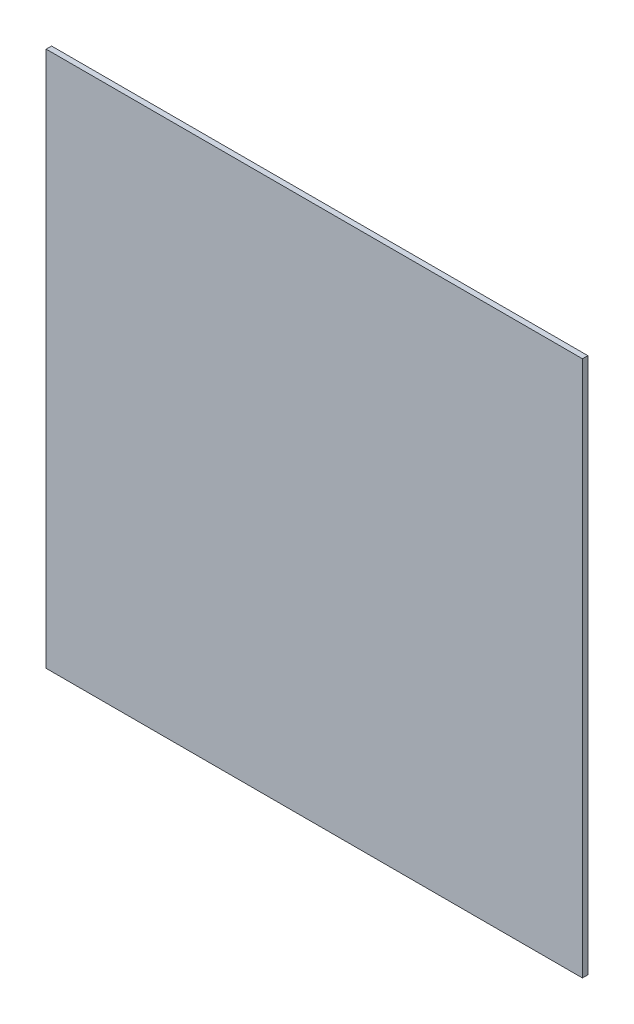
from build123d import *

# Parameters (mm, degrees)
SKETCH1_W           = 12.573
SKETCH1_H           = 12.573
BOSS_EXTRUDE1_DEPTH = 0.127
WRAP3_DEPTH         = 0.0254


# Read off the part's stored shape, not the designer's step: Wrap3
with BuildPart() as part:
    # Sketch1 → Boss-Extrude1 (new body)
    with BuildSketch(Plane.XY):
        with Locations((-12.7, -106.3625)):
            Rectangle(SKETCH1_W, SKETCH1_H)
    extrude(amount=BOSS_EXTRUDE1_DEPTH)

    # Wrap3 outline → Wrap3 (cut)
    # profile 1 of 7: a face of its own
    with BuildSketch(Plane.XY):
        with BuildLine():
            add(Edge.make_bspline(
                [(-14.420012161, -110.404390599), (-14.402067127, -110.404685135), (-14.368435947, -110.405237132), (-14.321816879, -110.41486782), (-14.281989467, -110.429283689), (-14.249047465, -110.450132857), (-14.22337003, -110.477658815), (-14.206106559, -110.511449866), (-14.194879537, -110.550675482), (-14.194017772, -110.578868519), (-14.193559673, -110.593855431)],
                knots=[0, 0, 0, 0, 0.159031159, 0.298043772, 0.420522955, 0.533343019, 0.640927553, 0.750451351, 0.867344419, 1, 1, 1, 1], degree=3))
            Line((-14.420012161, -110.404390599), (-15.545155125, -110.404390599))
            Line((-15.545155125, -110.404390599), (-15.545155125, -109.630526787))
            Line((-15.545155125, -109.630526787), (-14.756613257, -109.630526787))
            add(Edge.make_bspline(
                [(-14.512445471, -109.439061883), (-14.512654343, -109.454704013), (-14.513048204, -109.484199609), (-14.523992098, -109.525215161), (-14.542293289, -109.560343231), (-14.570025574, -109.588322996), (-14.605929257, -109.609317156), (-14.649498036, -109.622705682), (-14.700484045, -109.630927974), (-14.73700747, -109.63066692), (-14.756613257, -109.630526787)],
                knots=[0, 0, 0, 0, 0.130278168, 0.245659146, 0.351243539, 0.457674705, 0.570161798, 0.695317343, 0.836446248, 1, 1, 1, 1], degree=3))
            add(Edge.make_bspline(
                [(-14.766257906, -109.251599079), (-14.745028688, -109.25216019), (-14.705636029, -109.25320138), (-14.650881794, -109.259369804), (-14.60626865, -109.273761249), (-14.569582976, -109.291864533), (-14.542713034, -109.31902493), (-14.524616227, -109.3528551), (-14.513753098, -109.393710758), (-14.512902863, -109.423198595), (-14.512445471, -109.439061883)],
                knots=[0, 0, 0, 0, 0.174472791, 0.323749439, 0.450229917, 0.558081588, 0.656219595, 0.758386635, 0.870021586, 1, 1, 1, 1], degree=3))
            Line((-14.766257906, -109.251599079), (-15.545557745, -109.251599079))
            Line((-15.545557745, -109.251599079), (-15.545155125, -107.963381163))
            add(Edge.make_bspline(
                [(-15.731950153, -107.7145435), (-15.71675594, -107.714767904), (-15.687925924, -107.715193696), (-15.648036288, -107.726016918), (-15.614455204, -107.743782739), (-15.58704709, -107.769423906), (-15.567592363, -107.804923069), (-15.553875416, -107.849072912), (-15.546434131, -107.90309511), (-15.545603778, -107.942233893), (-15.545155125, -107.963381163)],
                knots=[0, 0, 0, 0, 0.126217153, 0.239488729, 0.340639109, 0.440250342, 0.547352353, 0.673922638, 0.82381553, 1, 1, 1, 1], degree=3))
            add(Edge.make_bspline(
                [(-15.924082833, -107.963253471), (-15.923675404, -107.94258761), (-15.9229125, -107.903891084), (-15.914806041, -107.850541553), (-15.90018749, -107.806317655), (-15.879453187, -107.770889155), (-15.851473737, -107.744540895), (-15.817443958, -107.725676084), (-15.776467965, -107.716305398), (-15.747333038, -107.715152314), (-15.731950153, -107.7145435)],
                knots=[0, 0, 0, 0, 0.170935714, 0.320074657, 0.444604709, 0.554426466, 0.655949305, 0.758896282, 0.872700184, 1, 1, 1, 1], degree=3))
            Line((-15.924082833, -107.963253471), (-15.924082182, -110.526475795))
            add(Edge.make_bspline(
                [(-15.668407139, -110.783318307), (-15.688710726, -110.784260337), (-15.726827739, -110.786028859), (-15.780919347, -110.777715826), (-15.826731865, -110.758918748), (-15.864425153, -110.730584857), (-15.89326065, -110.692526385), (-15.912243545, -110.644888266), (-15.923659881, -110.588618434), (-15.923935176, -110.548107991), (-15.924082182, -110.526475795)],
                knots=[0, 0, 0, 0, 0.143124528, 0.268695348, 0.382586136, 0.488926212, 0.597464291, 0.714854335, 0.847734893, 1, 1, 1, 1], degree=3))
            Line((-15.668407139, -110.783318307), (-14.419715082, -110.783318959))
            add(Edge.make_bspline(
                [(-14.193559673, -110.593855431), (-14.194272664, -110.6084063), (-14.195635346, -110.63621621), (-14.207470008, -110.674965668), (-14.225185318, -110.708601717), (-14.251392135, -110.735278224), (-14.283151213, -110.757445013), (-14.323019232, -110.771365847), (-14.369017652, -110.780873919), (-14.402089097, -110.782468891), (-14.419715082, -110.783318959)],
                knots=[0, 0, 0, 0, 0.130030465, 0.2485168, 0.359962038, 0.467049413, 0.580313493, 0.703881739, 0.842178774, 1, 1, 1, 1], degree=3))
        make_face()
    # profile 2 of 7: a face of its own
    with BuildSketch(Plane.XY):
        with BuildLine():
            add(Edge.make_bspline(
                [(-12.399946414, -107.853757003), (-12.3964285, -107.842319109), (-12.389713334, -107.820485896), (-12.373630553, -107.791556497), (-12.356123012, -107.766227783), (-12.333874206, -107.746537928), (-12.30897267, -107.730885302), (-12.280662932, -107.720109871), (-12.248950073, -107.714953342), (-12.226980265, -107.71468496), (-12.215400328, -107.7145435)],
                knots=[0, 0, 0, 0, 0.141702392, 0.270488466, 0.391455134, 0.505507001, 0.62056348, 0.739260185, 0.862568177, 1, 1, 1, 1], degree=3))
            Line((-12.399946414, -107.853757003), (-12.515227456, -108.226894925))
            Line((-12.515227456, -108.226894925), (-13.548145587, -108.226894925))
            Line((-13.548145587, -108.226894925), (-13.66773167, -107.831290393))
            add(Edge.make_bspline(
                [(-13.847855446, -107.7145435), (-13.826489776, -107.715443219), (-13.786680128, -107.717119623), (-13.732462683, -107.739595009), (-13.690074068, -107.778298159), (-13.675382757, -107.813143362), (-13.66773167, -107.831290393)],
                knots=[0, 0, 0, 0, 0.275840125, 0.513959899, 0.746875208, 1, 1, 1, 1], degree=3))
            add(Edge.make_bspline(
                [(-14.041321725, -107.881324775), (-14.040581244, -107.869643891), (-14.039133738, -107.846809881), (-14.026894541, -107.814948251), (-14.009408714, -107.785828774), (-13.984482547, -107.761823726), (-13.955444176, -107.741558416), (-13.922922313, -107.725926671), (-13.886283295, -107.717415229), (-13.861014825, -107.715526906), (-13.847855446, -107.7145435)],
                knots=[0, 0, 0, 0, 0.123314737, 0.241057959, 0.357426238, 0.480695961, 0.604213056, 0.731731648, 0.860290518, 1, 1, 1, 1], degree=3))
            add(Edge.make_bspline(
                [(-14.00465851, -108.040333782), (-14.008222837, -108.028475539), (-14.014846894, -108.006437804), (-14.023622636, -107.976422137), (-14.029348888, -107.951987934), (-14.035652691, -107.928885231), (-14.040515923, -107.906004185), (-14.041074192, -107.888905998), (-14.041321725, -107.881324775)],
                knots=[0, 0, 0, 0, 0.22700634, 0.421875753, 0.573150886, 0.686858716, 0.861155217, 1, 1, 1, 1], degree=3))
            Line((-14.00465851, -108.040333782), (-13.220090728, -110.651895314))
            add(Edge.make_bspline(
                [(-13.0359642, -110.783318959), (-13.047559052, -110.783502117), (-13.069562924, -110.7838497), (-13.100945981, -110.778006486), (-13.129610006, -110.769214837), (-13.154429771, -110.753990592), (-13.176197549, -110.735110697), (-13.194628405, -110.711559608), (-13.210033278, -110.683709337), (-13.216670262, -110.662715033), (-13.220090728, -110.651895314)],
                knots=[0, 0, 0, 0, 0.140277472, 0.266208441, 0.38561614, 0.501718756, 0.616402935, 0.733503765, 0.862657308, 1, 1, 1, 1], degree=3))
            add(Edge.make_bspline(
                [(-12.838014372, -110.609317879), (-12.842608884, -110.624803404), (-12.85120173, -110.653765073), (-12.869923861, -110.691576545), (-12.887775763, -110.723470343), (-12.910068499, -110.747000932), (-12.935238344, -110.764567825), (-12.964739093, -110.776738209), (-12.998987604, -110.78320923), (-13.023262764, -110.783281267), (-13.0359642, -110.783318959)],
                knots=[0, 0, 0, 0, 0.166404298, 0.311216181, 0.434859544, 0.542060845, 0.642692704, 0.749721755, 0.869047485, 1, 1, 1, 1], degree=3))
            Line((-12.838014372, -110.609317879), (-12.044616302, -108.008745669))
            add(Edge.make_bspline(
                [(-12.021266924, -107.890664527), (-12.021582814, -107.898899356), (-12.022208556, -107.915211569), (-12.025646837, -107.94125643), (-12.034470679, -107.972105538), (-12.040859927, -107.995179812), (-12.044616302, -108.008745669)],
                knots=[0, 0, 0, 0, 0.204595306, 0.40527887, 0.650350765, 1, 1, 1, 1], degree=3))
            add(Edge.make_bspline(
                [(-12.215400328, -107.7145435), (-12.20176455, -107.715141085), (-12.175700356, -107.716283341), (-12.138517339, -107.726252015), (-12.104883752, -107.741187131), (-12.076317329, -107.762906595), (-12.052135845, -107.788482835), (-12.034826462, -107.818904806), (-12.023516081, -107.853431229), (-12.022038253, -107.877895688), (-12.021266924, -107.890664527)],
                knots=[0, 0, 0, 0, 0.139395097, 0.266447653, 0.391794452, 0.513870771, 0.631533225, 0.749898934, 0.8694637, 1, 1, 1, 1], degree=3))
        make_face()
        Polygon((-13.428253303, -108.605822634), (-12.635119739, -108.605822634), (-13.031686521, -109.933666087), align=None, mode=Mode.SUBTRACT)
    # profile 3 of 7: a face of its own
    with BuildSketch(Plane.XY):
        with BuildLine():
            add(Edge.make_bspline(
                [(-11.671559946, -110.783318959), (-11.686505646, -110.783473507), (-11.714704518, -110.7837651), (-11.754357152, -110.775021057), (-11.788543816, -110.758936897), (-11.815621117, -110.733903064), (-11.837277286, -110.702157949), (-11.850488605, -110.662058354), (-11.859429309, -110.615386694), (-11.859599268, -110.581676924), (-11.859689224, -110.563834801)],
                knots=[0, 0, 0, 0, 0.133192919, 0.251302396, 0.359720634, 0.466653746, 0.576877875, 0.699449588, 0.840922754, 1, 1, 1, 1], degree=3))
            add(Edge.make_bspline(
                [(-11.488767669, -110.577444414), (-11.488842046, -110.594087032), (-11.488981482, -110.625287383), (-11.498015579, -110.668605177), (-11.511630851, -110.705656296), (-11.53189655, -110.735778365), (-11.558452166, -110.759076822), (-11.591349225, -110.774147214), (-11.629726618, -110.783017546), (-11.657052154, -110.783214429), (-11.671559946, -110.783318959)],
                knots=[0, 0, 0, 0, 0.156429936, 0.29326328, 0.414660319, 0.526240108, 0.631690942, 0.743211699, 0.863664847, 1, 1, 1, 1], degree=3))
            Line((-11.488767669, -110.577444414), (-11.488767669, -107.925355032))
            add(Edge.make_bspline(
                [(-11.671559946, -107.7145435), (-11.657049127, -107.714644447), (-11.629717888, -107.714834581), (-11.591378531, -107.723749929), (-11.558217631, -107.738729817), (-11.531908377, -107.762853823), (-11.511452422, -107.793719222), (-11.498066785, -107.831981913), (-11.489001438, -107.876452145), (-11.488848714, -107.908400872), (-11.488767669, -107.925355032)],
                knots=[0, 0, 0, 0, 0.134442412, 0.25322331, 0.363195825, 0.468548979, 0.580292874, 0.70386495, 0.842850663, 1, 1, 1, 1], degree=3))
            add(Edge.make_bspline(
                [(-11.83033572, -107.77858751), (-11.819334518, -107.768801818), (-11.797529203, -107.749405748), (-11.759045868, -107.728323683), (-11.716239553, -107.716867035), (-11.686748005, -107.715333346), (-11.671559946, -107.7145435)],
                knots=[0, 0, 0, 0, 0.250727995, 0.49696411, 0.740938031, 1, 1, 1, 1], degree=3))
            add(Edge.make_bspline(
                [(-11.859689876, -107.924898989), (-11.859430429, -107.914155725), (-11.858945436, -107.894073022), (-11.858809536, -107.866386731), (-11.856726633, -107.84365445), (-11.853535122, -107.821367216), (-11.847033739, -107.798435424), (-11.835713447, -107.784979685), (-11.83033572, -107.77858751)],
                knots=[0, 0, 0, 0, 0.210952489, 0.394339768, 0.543330692, 0.658159247, 0.837607901, 1, 1, 1, 1], degree=3))
            Line((-11.859689876, -107.924898989), (-11.859689224, -110.563834801))
        make_face()
    # profile 4 of 7: a face of its own
    with BuildSketch(Plane.XY):
        with BuildLine():
            add(Edge.make_bspline(
                [(-10.974280792, -110.577256785), (-10.974682129, -110.593723287), (-10.97543771, -110.624724065), (-10.983833674, -110.667936812), (-10.998731958, -110.704500765), (-11.019369938, -110.734610598), (-11.046626564, -110.757204147), (-11.078962134, -110.774029541), (-11.117782796, -110.78201221), (-11.145261756, -110.782868005), (-11.15974157, -110.783318959)],
                knots=[0, 0, 0, 0, 0.15480426, 0.291443332, 0.411506901, 0.524120187, 0.631009832, 0.741424809, 0.863745919, 1, 1, 1, 1], degree=3))
            Line((-10.974280792, -110.577256785), (-10.974280792, -108.050774551))
            Line((-10.974280792, -108.050774551), (-9.784129614, -108.050774551))
            add(Edge.make_bspline(
                [(-9.673386848, -108.038099174), (-9.679563102, -108.040294363), (-9.693610815, -108.04528726), (-9.718656198, -108.048640086), (-9.749402107, -108.050457061), (-9.77189301, -108.05066268), (-9.784129614, -108.050774551)],
                knots=[0, 0, 0, 0, 0.175063708, 0.398177405, 0.672566936, 1, 1, 1, 1], degree=3))
            add(Edge.make_bspline(
                [(-9.571983833, -107.88065765), (-9.573641145, -107.898049388), (-9.576963528, -107.93291429), (-9.599726186, -107.97931471), (-9.630931453, -108.018253096), (-9.659601972, -108.031655335), (-9.673386848, -108.038099174)],
                knots=[0, 0, 0, 0, 0.262542952, 0.526315115, 0.772250819, 1, 1, 1, 1], degree=3))
            add(Edge.make_bspline(
                [(-9.701406102, -107.719213376), (-9.692456485, -107.721673677), (-9.674780702, -107.726532851), (-9.649356261, -107.737420314), (-9.62818885, -107.755124459), (-9.602180311, -107.781291733), (-9.577929421, -107.823488725), (-9.573985701, -107.861408986), (-9.571983833, -107.88065765)],
                knots=[0, 0, 0, 0, 0.124715448, 0.246317044, 0.36758815, 0.492196285, 0.742234288, 1, 1, 1, 1], degree=3))
            add(Edge.make_bspline(
                [(-9.807636653, -107.7145435), (-9.79869004, -107.71459151), (-9.782405823, -107.714678894), (-9.760768108, -107.714161278), (-9.744554726, -107.715416764), (-9.730294794, -107.714989223), (-9.716413528, -107.716210348), (-9.706283341, -107.718237427), (-9.701406102, -107.719213376)],
                knots=[0, 0, 0, 0, 0.251947845, 0.458583968, 0.608995181, 0.709182393, 0.859984115, 1, 1, 1, 1], degree=3))
            Line((-9.807636653, -107.7145435), (-11.121048314, -107.7145435))
            add(Edge.make_bspline(
                [(-11.345202999, -107.941624024), (-11.345858275, -107.923057368), (-11.347079401, -107.888457844), (-11.339219735, -107.840309466), (-11.323981307, -107.800157992), (-11.30041872, -107.767554737), (-11.267342027, -107.743670287), (-11.225879344, -107.727259861), (-11.176262273, -107.7167274), (-11.140231725, -107.71530227), (-11.121048314, -107.7145435)],
                knots=[0, 0, 0, 0, 0.148769811, 0.277237025, 0.388553675, 0.490606392, 0.595154956, 0.711121117, 0.846194886, 1, 1, 1, 1], degree=3))
            Line((-11.345202999, -107.941624024), (-11.345202348, -110.577844428))
            add(Edge.make_bspline(
                [(-11.15974157, -110.783318959), (-11.174013575, -110.782914673), (-11.200863995, -110.782154076), (-11.239044834, -110.773611129), (-11.271368022, -110.757397825), (-11.298823902, -110.734777455), (-11.318661809, -110.704280961), (-11.333589143, -110.667891807), (-11.342594129, -110.624953753), (-11.34430123, -110.5941203), (-11.345202348, -110.577844428)],
                knots=[0, 0, 0, 0, 0.135058758, 0.254090738, 0.367120403, 0.474721439, 0.586884361, 0.707746998, 0.845730148, 1, 1, 1, 1], degree=3))
        make_face()
    # profile 5 of 7: a face of its own
    with BuildSketch(Plane.XY):
        with BuildLine():
            add(Edge.make_bspline(
                [(-13.364436924, -103.369511903), (-13.343551002, -103.390867707), (-13.302683247, -103.432654887), (-13.250263475, -103.501786224), (-13.206043382, -103.573677921), (-13.170509347, -103.64944877), (-13.141955327, -103.728344234), (-13.123192815, -103.811275482), (-13.111067747, -103.897469621), (-13.110635525, -103.956053284), (-13.110415361, -103.985894451)],
                knots=[0, 0, 0, 0, 0.130448083, 0.255249458, 0.378266884, 0.49869614, 0.62043218, 0.744203675, 0.86970325, 1, 1, 1, 1], degree=3))
            Line((-13.364436924, -103.369511903), (-13.369048166, -103.369511903))
            Line((-13.369048166, -103.369511903), (-13.387272278, -103.365468108))
            add(Edge.make_bspline(
                [(-13.110415361, -102.645640126), (-13.110864025, -102.679481377), (-13.111743743, -102.745835607), (-13.124311938, -102.842930729), (-13.143956259, -102.935542654), (-13.173011266, -103.024121275), (-13.211975991, -103.110142204), (-13.260478898, -103.195644265), (-13.31837208, -103.282198755), (-13.363857314, -103.337169947), (-13.387272278, -103.365468108)],
                knots=[0, 0, 0, 0, 0.128444356, 0.251847255, 0.371120416, 0.487567242, 0.605135768, 0.729169992, 0.860581679, 1, 1, 1, 1], degree=3))
            add(Edge.make_bspline(
                [(-13.437973785, -101.852428382), (-13.41353799, -101.874488773), (-13.364189668, -101.919039941), (-13.30082664, -101.99868366), (-13.244722906, -102.087394187), (-13.197521149, -102.18574958), (-13.15976818, -102.291774654), (-13.131456562, -102.404277958), (-13.114861875, -102.523073062), (-13.111917728, -102.604227748), (-13.110415361, -102.645640126)],
                knots=[0, 0, 0, 0, 0.111467294, 0.22510926, 0.34372318, 0.466818214, 0.594181077, 0.724757774, 0.859546802, 1, 1, 1, 1], degree=3))
            add(Edge.make_bspline(
                [(-13.917785923, -101.70165811), (-13.893268052, -101.702058417), (-13.845760334, -101.702834083), (-13.777124423, -101.708305611), (-13.714067791, -101.719931296), (-13.655551872, -101.735366429), (-13.599669901, -101.755795562), (-13.544960462, -101.781918573), (-13.490531712, -101.814157273), (-13.455786315, -101.839457831), (-13.437973785, -101.852428382)],
                knots=[0, 0, 0, 0, 0.143289664, 0.277649108, 0.401784546, 0.51747006, 0.630937378, 0.748935385, 0.871289538, 1, 1, 1, 1], degree=3))
            Line((-13.917785923, -101.70165811), (-14.600105709, -101.70165811))
            add(Edge.make_bspline(
                [(-14.826200529, -101.943636892), (-14.826843153, -101.922776594), (-14.82802591, -101.884382953), (-14.820865588, -101.831202953), (-14.806974786, -101.787486012), (-14.783953841, -101.752845251), (-14.750777815, -101.728494681), (-14.708766819, -101.712227062), (-14.657483918, -101.70238624), (-14.620168821, -101.701912711), (-14.600105709, -101.70165811)],
                knots=[0, 0, 0, 0, 0.158927213, 0.292507531, 0.407271171, 0.506049917, 0.604068815, 0.715862285, 0.847228411, 1, 1, 1, 1], degree=3))
            Line((-14.826200529, -101.943636892), (-14.825593993, -104.537606908))
            add(Edge.make_bspline(
                [(-14.600249688, -104.770432917), (-14.619609733, -104.769681965), (-14.655819152, -104.768277447), (-14.705390978, -104.757790872), (-14.746389581, -104.741510035), (-14.778226404, -104.717132653), (-14.801367352, -104.684341554), (-14.816059039, -104.642928819), (-14.825536424, -104.593187186), (-14.8255739, -104.557005649), (-14.825593993, -104.537606908)],
                knots=[0, 0, 0, 0, 0.153417679, 0.286939669, 0.399947666, 0.500488246, 0.600330349, 0.713654415, 0.846475742, 1, 1, 1, 1], degree=3))
            Line((-14.600249688, -104.770432917), (-13.80222409, -104.770433568))
            add(Edge.make_bspline(
                [(-13.110415361, -103.985894451), (-13.111608349, -104.013491838), (-13.113953445, -104.067740955), (-13.12362391, -104.147315478), (-13.140730357, -104.223025687), (-13.162561442, -104.295154292), (-13.189872983, -104.363648436), (-13.22336287, -104.428037475), (-13.263122687, -104.488445489), (-13.308137661, -104.544822429), (-13.357919043, -104.59605491), (-13.411425533, -104.640888866), (-13.468145159, -104.67940466), (-13.528078518, -104.711747533), (-13.592178252, -104.73612892), (-13.659017516, -104.755275864), (-13.729607383, -104.766401468), (-13.777728065, -104.769073407), (-13.80222409, -104.770433568)],
                knots=[0, 0, 0, 0, 0.071163137, 0.139887785, 0.206200628, 0.270907243, 0.333896404, 0.395916463, 0.457578168, 0.51994926, 0.581539044, 0.641330138, 0.699495776, 0.757940144, 0.816356419, 0.875858538, 0.936805293, 1, 1, 1, 1], degree=3))
        make_face()
        with BuildLine():
            add(Edge.make_bspline(
                [(-13.834783573, -104.391505209), (-13.820819363, -104.391353895), (-13.794831799, -104.391072299), (-13.758248148, -104.389644112), (-13.727090147, -104.384728809), (-13.691786318, -104.377205576), (-13.651737204, -104.35920387), (-13.626424956, -104.336027448), (-13.613427686, -104.324126876)],
                knots=[0, 0, 0, 0, 0.175434205, 0.326485192, 0.459200983, 0.570988135, 0.779712054, 1, 1, 1, 1], degree=3))
            Line((-13.834783573, -104.391505209), (-14.448078713, -104.391505209))
            Line((-14.448078713, -104.391505209), (-14.448078713, -103.57494539))
            Line((-14.448078713, -103.57494539), (-13.829576219, -103.57494539))
            add(Edge.make_bspline(
                [(-13.608757811, -103.651664776), (-13.62168785, -103.638630602), (-13.64665764, -103.613459712), (-13.686923654, -103.593145093), (-13.722272877, -103.583416746), (-13.753593882, -103.5784128), (-13.789914117, -103.574895705), (-13.815778688, -103.574928106), (-13.829576219, -103.57494539)],
                knots=[0, 0, 0, 0, 0.226233756, 0.436890346, 0.548504896, 0.679825828, 0.829202146, 1, 1, 1, 1], degree=3))
            add(Edge.make_bspline(
                [(-13.488675293, -103.985894451), (-13.490165984, -103.952828911), (-13.49303484, -103.889193819), (-13.516233177, -103.79916238), (-13.553551677, -103.718414335), (-13.590379939, -103.673885402), (-13.608757811, -103.651664776)],
                knots=[0, 0, 0, 0, 0.272613178, 0.524647865, 0.76279194, 1, 1, 1, 1], degree=3))
            add(Edge.make_bspline(
                [(-13.613427686, -104.324126876), (-13.594605577, -104.301699705), (-13.556793197, -104.256644992), (-13.518082495, -104.174796122), (-13.494611555, -104.083472872), (-13.490700014, -104.019176192), (-13.488675293, -103.985894451)],
                knots=[0, 0, 0, 0, 0.237392928, 0.476906795, 0.729232475, 1, 1, 1, 1], degree=3))
        make_face(mode=Mode.SUBTRACT)
        with BuildLine():
            add(Edge.make_bspline(
                [(-13.913174681, -103.196017681), (-13.890591744, -103.195859514), (-13.849400312, -103.195571017), (-13.791598982, -103.184785832), (-13.740298055, -103.163941657), (-13.71127525, -103.142048696), (-13.696151199, -103.130640073)],
                knots=[0, 0, 0, 0, 0.291508259, 0.531713047, 0.75597136, 1, 1, 1, 1], degree=3))
            Line((-13.913174681, -103.196017681), (-14.471134922, -103.196017681))
            Line((-14.471134922, -103.196017681), (-14.471134922, -102.080585166))
            Line((-14.471134922, -102.080585166), (-13.944988861, -102.080585166))
            add(Edge.make_bspline(
                [(-13.63610994, -102.198666309), (-13.644947365, -102.188168565), (-13.662122826, -102.167766288), (-13.692036818, -102.142244869), (-13.723590794, -102.12134915), (-13.757950927, -102.104521846), (-13.796862598, -102.093626353), (-13.84084613, -102.085601457), (-13.890859473, -102.08111539), (-13.926300894, -102.080768224), (-13.944988861, -102.080585166)],
                knots=[0, 0, 0, 0, 0.119313871, 0.231885509, 0.340904025, 0.448294015, 0.563466716, 0.691452478, 0.837305457, 1, 1, 1, 1], degree=3))
            add(Edge.make_bspline(
                [(-13.488675293, -102.636300374), (-13.48919943, -102.614927523), (-13.490229004, -102.572944353), (-13.497985222, -102.511448695), (-13.509005525, -102.452459016), (-13.525102105, -102.396188594), (-13.545811422, -102.342566033), (-13.571291277, -102.291653031), (-13.601298583, -102.243439391), (-13.624501867, -102.213596183), (-13.63610994, -102.198666309)],
                knots=[0, 0, 0, 0, 0.136018339, 0.267183868, 0.39406249, 0.517733739, 0.639189461, 0.759476315, 0.879671503, 1, 1, 1, 1], degree=3))
            add(Edge.make_bspline(
                [(-13.696151199, -103.130640073), (-13.680857501, -103.117019573), (-13.649850044, -103.089404467), (-13.609901776, -103.039871526), (-13.574494664, -102.984100629), (-13.543663059, -102.922370853), (-13.520430848, -102.855116377), (-13.501851114, -102.784771139), (-13.491294396, -102.711333153), (-13.489553505, -102.661459645), (-13.488675293, -102.636300374)],
                knots=[0, 0, 0, 0, 0.110984547, 0.225017424, 0.343859372, 0.469068413, 0.598464438, 0.729298708, 0.863441586, 1, 1, 1, 1], degree=3))
        make_face(mode=Mode.SUBTRACT)
    # profile 6 of 7: a face of its own
    with BuildSketch(Plane.XY):
        with BuildLine():
            add(Edge.make_bspline(
                [(-12.782723512, -104.770433568), (-12.797669212, -104.770588116), (-12.825868084, -104.770879709), (-12.865520718, -104.762135667), (-12.899707382, -104.746051506), (-12.926784683, -104.721017674), (-12.948440852, -104.689272558), (-12.961652171, -104.649172963), (-12.970592875, -104.602501303), (-12.970762834, -104.568791533), (-12.97085279, -104.55094941)],
                knots=[0, 0, 0, 0, 0.133192919, 0.251302396, 0.359720634, 0.466653746, 0.576877875, 0.699449588, 0.840922754, 1, 1, 1, 1], degree=3))
            add(Edge.make_bspline(
                [(-12.599931235, -104.564559023), (-12.600005612, -104.581201642), (-12.600145048, -104.612401993), (-12.609179145, -104.655719786), (-12.622794417, -104.692770905), (-12.643060116, -104.722892975), (-12.669615732, -104.746191431), (-12.702512791, -104.761261823), (-12.740890184, -104.770132156), (-12.76821572, -104.770329038), (-12.782723512, -104.770433568)],
                knots=[0, 0, 0, 0, 0.156429936, 0.29326328, 0.414660319, 0.526240108, 0.631690942, 0.743211699, 0.863664847, 1, 1, 1, 1], degree=3))
            Line((-12.599931235, -104.564559023), (-12.599931235, -101.912469641))
            add(Edge.make_bspline(
                [(-12.782723512, -101.70165811), (-12.768212693, -101.701759056), (-12.740881454, -101.70194919), (-12.702542097, -101.710864539), (-12.669381197, -101.725844426), (-12.643071943, -101.749968433), (-12.622615988, -101.780833831), (-12.609230351, -101.819096522), (-12.600165004, -101.863566755), (-12.60001228, -101.895515481), (-12.599931235, -101.912469641)],
                knots=[0, 0, 0, 0, 0.134442412, 0.25322331, 0.363195825, 0.468548979, 0.580292874, 0.70386495, 0.842850663, 1, 1, 1, 1], degree=3))
            add(Edge.make_bspline(
                [(-12.941499286, -101.765702119), (-12.930498084, -101.755916427), (-12.908692769, -101.736520358), (-12.870209434, -101.715438292), (-12.827403119, -101.703981645), (-12.797911571, -101.702447955), (-12.782723512, -101.70165811)],
                knots=[0, 0, 0, 0, 0.250727995, 0.49696411, 0.740938031, 1, 1, 1, 1], degree=3))
            add(Edge.make_bspline(
                [(-12.970853442, -101.912013599), (-12.970593995, -101.901270335), (-12.970109002, -101.881187631), (-12.969973102, -101.85350134), (-12.967890199, -101.830769059), (-12.964698688, -101.808481825), (-12.958197305, -101.785550033), (-12.946877013, -101.772094294), (-12.941499286, -101.765702119)],
                knots=[0, 0, 0, 0, 0.210952489, 0.394339768, 0.543330692, 0.658159247, 0.837607901, 1, 1, 1, 1], degree=3))
            Line((-12.970853442, -101.912013599), (-12.97085279, -104.55094941))
        make_face()
    # profile 7 of 7: a face of its own
    with BuildSketch(Plane.XY):
        with BuildLine():
            add(Edge.make_bspline(
                [(-10.941792582, -104.391505209), (-10.923366453, -104.392173948), (-10.888668804, -104.393433231), (-10.840364413, -104.401846827), (-10.799122522, -104.415798085), (-10.764760313, -104.435591004), (-10.738763335, -104.462798952), (-10.719359516, -104.494734101), (-10.708796625, -104.532975611), (-10.707292271, -104.560005516), (-10.706496777, -104.574298789)],
                knots=[0, 0, 0, 0, 0.162897657, 0.306747336, 0.431731416, 0.546374995, 0.653433857, 0.760997037, 0.873616484, 1, 1, 1, 1], degree=3))
            Line((-10.941792582, -104.391505209), (-11.398305506, -104.391505209))
            Line((-11.398305506, -104.391505209), (-11.398305506, -101.93581902))
            add(Edge.make_bspline(
                [(-11.585100533, -101.70165811), (-11.569924784, -101.701435021), (-11.541439022, -101.701016272), (-11.501401535, -101.710541156), (-11.467393569, -101.727986481), (-11.440572709, -101.754907503), (-11.419451948, -101.789015846), (-11.406131208, -101.83136213), (-11.397892242, -101.881010436), (-11.398161008, -101.916655158), (-11.398305506, -101.93581902)],
                knots=[0, 0, 0, 0, 0.1303468, 0.244668505, 0.350952396, 0.455284039, 0.568004952, 0.693428508, 0.835176339, 1, 1, 1, 1], degree=3))
            add(Edge.make_bspline(
                [(-11.740540682, -101.765702119), (-11.730462732, -101.756104028), (-11.710403151, -101.736999578), (-11.673160644, -101.716644868), (-11.630765342, -101.704485764), (-11.600751444, -101.702627245), (-11.585100533, -101.70165811)],
                knots=[0, 0, 0, 0, 0.240761183, 0.479221355, 0.728437127, 1, 1, 1, 1], degree=3))
            add(Edge.make_bspline(
                [(-11.777233214, -101.95849997), (-11.777371869, -101.944042244), (-11.777625799, -101.917564887), (-11.776068401, -101.881551505), (-11.77453216, -101.852518834), (-11.770217774, -101.824001941), (-11.762120558, -101.79360692), (-11.747661405, -101.774909882), (-11.740540682, -101.765702119)],
                knots=[0, 0, 0, 0, 0.216060692, 0.395685733, 0.538969935, 0.649917571, 0.82759431, 1, 1, 1, 1], degree=3))
            Line((-11.777233214, -101.95849997), (-11.777233214, -104.391505209))
            Line((-11.777233214, -104.391505209), (-12.238216006, -104.391506511))
            add(Edge.make_bspline(
                [(-12.468374165, -104.588308416), (-12.467616393, -104.572887927), (-12.466189792, -104.543856915), (-12.455289508, -104.503153012), (-12.437419381, -104.468143389), (-12.410757158, -104.440226027), (-12.378120516, -104.417447666), (-12.337509565, -104.40254622), (-12.290233487, -104.393222644), (-12.256279904, -104.392102466), (-12.238216006, -104.391506511)],
                knots=[0, 0, 0, 0, 0.13367795, 0.251665576, 0.363042966, 0.47093762, 0.583363643, 0.705585, 0.843366093, 1, 1, 1, 1], degree=3))
            add(Edge.make_bspline(
                [(-12.219912413, -104.770432917), (-12.239619377, -104.77035753), (-12.276498085, -104.770216456), (-12.327982871, -104.761239188), (-12.371744023, -104.747589854), (-12.408714164, -104.728644808), (-12.436002771, -104.701346243), (-12.45639628, -104.669215657), (-12.466821506, -104.63028389), (-12.467837539, -104.602815863), (-12.468374165, -104.588308416)],
                knots=[0, 0, 0, 0, 0.167323449, 0.313121427, 0.442287347, 0.556528349, 0.662166905, 0.766596956, 0.876726412, 1, 1, 1, 1], degree=3))
            Line((-12.219912413, -104.770432917), (-10.931985061, -104.770433568))
            add(Edge.make_bspline(
                [(-10.706496777, -104.574298789), (-10.707258731, -104.58971516), (-10.708693204, -104.618738419), (-10.719540706, -104.6594943), (-10.737523732, -104.694189561), (-10.763161791, -104.722450293), (-10.795626555, -104.744359528), (-10.835101442, -104.759350322), (-10.881295466, -104.768730217), (-10.914366509, -104.769841522), (-10.931985061, -104.770433568)],
                knots=[0, 0, 0, 0, 0.13549594, 0.255088173, 0.36798027, 0.476021954, 0.587257675, 0.709320559, 0.84514094, 1, 1, 1, 1], degree=3))
        make_face()
    extrude(amount=WRAP3_DEPTH, mode=Mode.SUBTRACT)


solid = part.part
